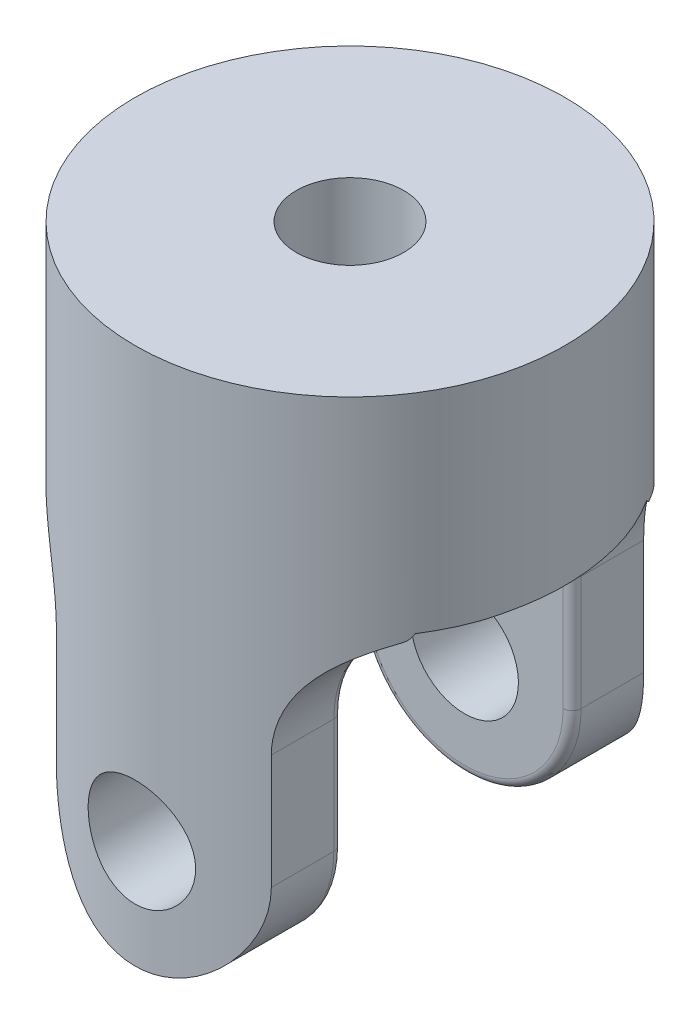
from build123d import *

# Parameters (mm, degrees)
SKETCH1_R               = 19.05
BASE_EXTRUDE_DEPTH      = 47.625
CUT_EXTRUDE1_DEPTH      = 55.716959208
CUT_EXTRUDE1_DEPTH_BACK = 55.716959208
CUT_EXTRUDE5_DEPTH      = 47.625
CUT_EXTRUDE5_DEPTH_BACK = 55.716959365
SKETCH8_W               = 20.32
SKETCH8_H               = 36.600526062
FILLET1_R               = 0.8001
CUT_EXTRUDE6_DEPTH      = 55.716959365
CUT_EXTRUDE6_DEPTH_BACK = 55.716959365
SKETCH11_R              = 4.7625
SKETCH12_R              = 4.7625
CUT_EXTRUDE7_DEPTH      = 55.716959365


with BuildPart() as part:
    # Sketch1 → Base-Extrude (new body)
    with BuildSketch(Plane(origin=(0, 0, 0), x_dir=(-1, 0, 0), z_dir=(0, 1, 0))):
        with Locations(Location((0, 0, 0), (0, 0, 90))):
            Circle(SKETCH1_R)
    extrude(amount=BASE_EXTRUDE_DEPTH)

    # Sketch2 → Cut-Extrude1 (cut, two sides: drawn at the far end of the back side and taken through both)
    with BuildSketch(Plane.XY.offset(-CUT_EXTRUDE1_DEPTH_BACK)):
        with BuildLine():
            Line((9.525, 9.525), (9.525, 19.685))
            ThreePointArc((9.525, 19.685), (12.314807909, 26.420192091), (19.05, 29.21))
            Line((19.05, 29.21), (19.05, -1.366191125))
            Line((19.05, -1.366191125), (-19.05, -1.366191125))
            Line((-19.05, -1.366191125), (-19.05, 29.21))
            ThreePointArc((-19.05, 29.21), (-12.314807909, 26.420192091), (-9.525, 19.685))
            Line((-9.525, 19.685), (-9.525, 9.525))
            ThreePointArc((-9.525, 9.525), (0, 0), (9.525, 9.525))
        make_face()
    extrude(amount=CUT_EXTRUDE1_DEPTH + CUT_EXTRUDE1_DEPTH_BACK, mode=Mode.SUBTRACT)

    # Sketch8 → Cut-Extrude5 (cut, two sides: drawn at the far end of the back side and taken through both)
    with BuildSketch(Plane(origin=(0, 0, 0), x_dir=(0, 0, -1), z_dir=(1, 0, 0)).offset(-CUT_EXTRUDE5_DEPTH_BACK)):
        with Locations((0, 10.844975795)):
            Rectangle(SKETCH8_W, SKETCH8_H)
    extrude(amount=CUT_EXTRUDE5_DEPTH + CUT_EXTRUDE5_DEPTH_BACK, mode=Mode.SUBTRACT)

    # Fillet1
    # the kernel refuses this fillet: 0.8001 mm, written as the material it takes off along each edge
    with BuildSketch(Plane(origin=(0, 9.525, -10.16), x_dir=(1, 0, 0), z_dir=(0, 1, 0))) as fillet1_piece_1:
        with BuildLine():
            CenterArc((9.525 - FILLET1_R, FILLET1_R), FILLET1_R, 270, 90)
            Line((9.525, FILLET1_R), (9.525, 0))
            Line((9.525, 0), (9.525 - FILLET1_R, 0))
        make_face()
    revolve(axis=Axis((0, 9.525, -10.16), (0, 0, -1)), revolution_arc=180, mode=Mode.SUBTRACT)
    with BuildSketch(Plane(origin=(0, 9.525, 10.16), x_dir=(1, 0, 0), z_dir=(0, 1, 0))) as fillet1_piece_2:
        with BuildLine():
            CenterArc((9.525 - FILLET1_R, -FILLET1_R), FILLET1_R, 0, 90)
            Line((9.525 - FILLET1_R, 0), (9.525, 0))
            Line((9.525, 0), (9.525, -FILLET1_R))
        make_face()
    revolve(axis=Axis((0, 9.525, 10.16), (0, 0, -1)), revolution_arc=180, mode=Mode.SUBTRACT)
    with BuildSketch(Plane(origin=(9.525, 19.685, 10.16), x_dir=(0, 0, 1), z_dir=(0, -1, 0))) as fillet1_piece_3:
        with BuildLine():
            CenterArc((FILLET1_R, FILLET1_R), FILLET1_R, 180, 90)
            Line((0, FILLET1_R), (0, 0))
            Line((0, 0), (FILLET1_R, 0))
        make_face()
    extrude(amount=10.16, mode=Mode.SUBTRACT)
    with BuildSketch(Plane(origin=(19.05, 19.685, 10.16), x_dir=(-1, 0, 0), z_dir=(0, -1, 0))) as fillet1_piece_4_section:
        with BuildLine():
            CenterArc((9.525 + FILLET1_R, -FILLET1_R), FILLET1_R, 90, 90)
            Line((9.525 + FILLET1_R, 0), (9.525, 0))
            Line((9.525, 0), (9.525, -FILLET1_R))
        make_face()
    fillet1_piece_4 = revolve(axis=Axis((19.05, 19.685, 10.16), (0, 0, -1)), revolution_arc=84.085046105, mode=Mode.PRIVATE)
    fillet1_piece_4 = split(fillet1_piece_4, bisect_by=Plane(origin=(11.180350867, 29.145238826, 10.386376784), z_dir=(0, -1, 0)), keep=Keep.TOP, mode=Mode.PRIVATE)
    add(fillet1_piece_4, mode=Mode.SUBTRACT)
    with BuildSketch(Plane(origin=(19.05, 19.685, -10.16), x_dir=(-1, 0, 0), z_dir=(0, -1, 0))) as fillet1_piece_5_section:
        with BuildLine():
            CenterArc((9.525 + FILLET1_R, FILLET1_R), FILLET1_R, 180, 90)
            Line((9.525, FILLET1_R), (9.525, 0))
            Line((9.525, 0), (9.525 + FILLET1_R, 0))
        make_face()
    fillet1_piece_5 = revolve(axis=Axis((19.05, 19.685, -10.16), (0, 0, -1)), revolution_arc=84.085046117, mode=Mode.PRIVATE)
    fillet1_piece_5 = split(fillet1_piece_5, bisect_by=Plane(origin=(9.358714509, 29.145238826, -10.293177934), z_dir=(0, -1, 0)), keep=Keep.TOP, mode=Mode.PRIVATE)
    add(fillet1_piece_5, mode=Mode.SUBTRACT)
    with BuildSketch(Plane(origin=(9.525, 9.525, -10.16), x_dir=(-1, 0, 0), z_dir=(0, 1, 0)), Plane(origin=(-9.525, 9.525, 10.16), x_dir=(1, 0, 0), z_dir=(0, 1, 0)), Plane(origin=(-9.525, 19.685, -10.16), x_dir=(1, 0, 0), z_dir=(0, -1, 0))) as fillet1_piece_6:
        with BuildLine():
            CenterArc((FILLET1_R, -FILLET1_R), FILLET1_R, 90, 90)
            Line((0, -FILLET1_R), (0, 0))
            Line((0, 0), (FILLET1_R, 0))
        make_face()
    extrude(amount=10.16, mode=Mode.SUBTRACT)
    with BuildSketch(Plane(origin=(-19.05, 19.685, 10.16), x_dir=(0.1030521452465983, 0.9946759549522016, 0), z_dir=(-0.9946759549522016, 0.1030521452465983, 0))) as fillet1_piece_7_section:
        with BuildLine():
            CenterArc((9.525 + FILLET1_R, -FILLET1_R), FILLET1_R, 90, 90)
            Line((9.525, -FILLET1_R), (9.525, 0))
            Line((9.525, 0), (9.525 + FILLET1_R, 0))
        make_face()
    fillet1_piece_7 = revolve(axis=Axis((-19.05, 19.685, 10.16), (0, 0, -1)), revolution_arc=84.085046117, mode=Mode.PRIVATE)
    fillet1_piece_7 = split(fillet1_piece_7, bisect_by=Plane(origin=(-11.180351388, 29.145238826, 10.386376138), z_dir=(0, -1, 0)), keep=Keep.TOP, mode=Mode.PRIVATE)
    add(fillet1_piece_7, mode=Mode.SUBTRACT)
    with BuildSketch(Plane(origin=(-19.05, 19.685, -10.16), x_dir=(0.10305214545411669, 0.9946759549307018, 0), z_dir=(-0.9946759549307018, 0.10305214545411669, 0))) as fillet1_piece_8_section:
        with BuildLine():
            CenterArc((9.525 + FILLET1_R, FILLET1_R), FILLET1_R, 180, 90)
            Line((9.525, FILLET1_R), (9.525, 0))
            Line((9.525, 0), (9.525 + FILLET1_R, 0))
        make_face()
    fillet1_piece_8 = revolve(axis=Axis((-19.05, 19.685, -10.16), (0, 0, -1)), revolution_arc=84.085046105, mode=Mode.PRIVATE)
    fillet1_piece_8 = split(fillet1_piece_8, bisect_by=Plane(origin=(-11.180351387, 29.145238826, -10.386376139), z_dir=(0, -1, 0)), keep=Keep.TOP, mode=Mode.PRIVATE)
    add(fillet1_piece_8, mode=Mode.SUBTRACT)

    # Sketch11 → Cut-Extrude6 (cut, two sides: drawn at the far end of the back side and taken through both)
    with BuildSketch(Plane.XY.offset(-CUT_EXTRUDE6_DEPTH_BACK)):
        with Locations(Location((0, 9.525, 0), (0, 0, 270))):
            Circle(SKETCH11_R)
    extrude(amount=CUT_EXTRUDE6_DEPTH + CUT_EXTRUDE6_DEPTH_BACK, mode=Mode.SUBTRACT)

    # Sketch12 → Cut-Extrude7 (cut, through all)
    with BuildSketch(Plane(origin=(0, 47.625, 0), x_dir=(-1, 0, 0), z_dir=(0, 1, 0))):
        with Locations(Location((0, 0, 0), (0, 0, 90))):
            Circle(SKETCH12_R)
    extrude(amount=-CUT_EXTRUDE7_DEPTH, mode=Mode.SUBTRACT)


solid = part.part
